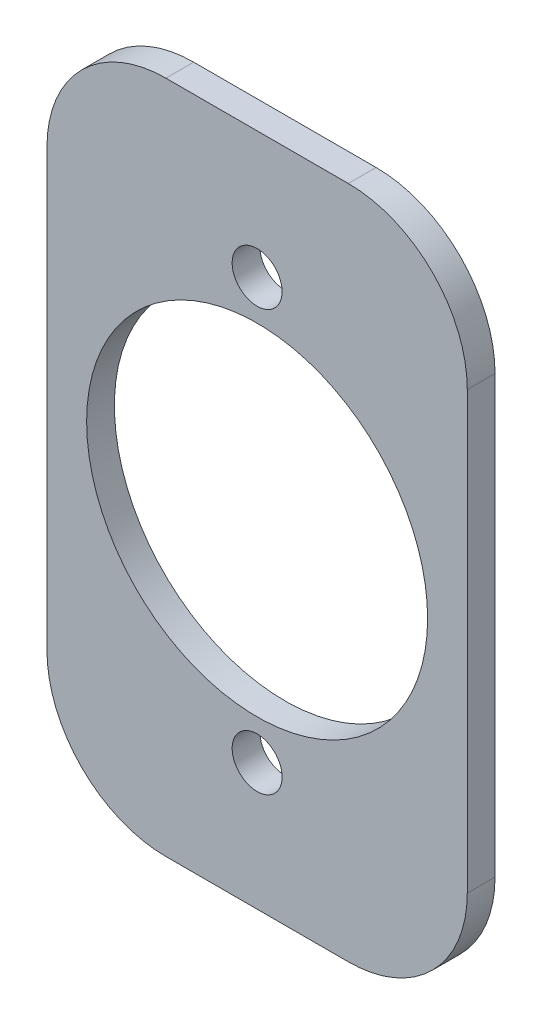
from build123d import *

# Parameters (mm, degrees)
BOSS_EXTRUDE1_DEPTH = 5
SKETCH4_W           = 53
SKETCH4_H           = 85
BOSS_EXTRUDE2_DEPTH = 3.5
SKETCH2_R           = 21.5
CUT_EXTRUDE1_DEPTH  = 74.391075752
SKETCH3_R           = 3.15
CUT_EXTRUDE2_DEPTH  = 74.391075752
SKETCH16_W          = 82.074163125
SKETCH16_H          = 140.053159095
SKETCH16_W_2        = 53
SKETCH16_H_2        = 85
LAZY_CUT_DEPTH      = 74.068461049
FILLET1_R           = 15
SKETCH17_W          = 53
SKETCH17_H          = 5
CUT_EXTRUDE7_DEPTH  = 90.175388981


with BuildPart() as part:
    # Sketch1 → Boss-Extrude1 (new body)
    with BuildSketch(Plane.XY):
        with BuildLine():
            Line((25, 65), (-25, 65))
            ThreePointArc((-25, 65), (-30.656854249, 62.656854249), (-33, 57))
            Line((-33, 57), (-33, -57))
            ThreePointArc((-33, -57), (-30.656854249, -62.656854249), (-25, -65))
            Line((-25, -65), (25, -65))
            ThreePointArc((25, -65), (30.656854249, -62.656854249), (33, -57))
            Line((33, -57), (33, 57))
            ThreePointArc((33, 57), (30.656854249, 62.656854249), (25, 65))
        make_face()
    extrude(amount=BOSS_EXTRUDE1_DEPTH)

    # Sketch4 → Boss-Extrude2 (add)
    with BuildSketch(Plane(origin=(0, 0, 0), x_dir=(-1, 0, 0), z_dir=(0, 0, -1))):
        Rectangle(SKETCH4_W, SKETCH4_H)
    extrude(amount=BOSS_EXTRUDE2_DEPTH)

    # Sketch2 → Cut-Extrude1 (cut, through all)
    with BuildSketch(Plane.XY.offset(5)):
        Circle(SKETCH2_R)
    extrude(amount=-CUT_EXTRUDE1_DEPTH, mode=Mode.SUBTRACT)

    # Sketch3 → Cut-Extrude2 (cut, through all)
    with BuildSketch(Plane.XY.offset(5)):
        with Locations((0, 26.5)):
            Circle(SKETCH3_R)
        with Locations((0, -26.5)):
            Circle(SKETCH3_R)
    extrude(amount=-CUT_EXTRUDE2_DEPTH, mode=Mode.SUBTRACT)

    # Sketch16 → lazy cut (cut, through all)
    with BuildSketch(Plane(origin=(0, 0, 0), x_dir=(-1, 0, 0), z_dir=(0, 0, -1))):
        with Locations((0.978866165, -0.150594795)):
            Rectangle(SKETCH16_W, SKETCH16_H)
        Rectangle(SKETCH16_W_2, SKETCH16_H_2, mode=Mode.SUBTRACT)
    extrude(amount=-LAZY_CUT_DEPTH, mode=Mode.SUBTRACT)

    # Fillet1
    fillet1_edges = [part.edges().sort_by_distance(p)[0] for p in [
        (-26.5, -42.5, 0.75),
        (26.5, -42.5, 0.75),
        (26.5, 42.5, 0.75),
        (-26.5, 42.5, 0.75),
    ]]
    fillet(fillet1_edges, radius=FILLET1_R)

    # Sketch17 → Cut-Extrude7 (cut, through all)
    with BuildSketch(Plane(origin=(0, 42.5, 0), x_dir=(1, 0, 0), z_dir=(0, 1, 0))):
        with Locations((0, -2.5)):
            Rectangle(SKETCH17_W, SKETCH17_H)
    extrude(amount=-CUT_EXTRUDE7_DEPTH, mode=Mode.SUBTRACT)


solid = part.part
